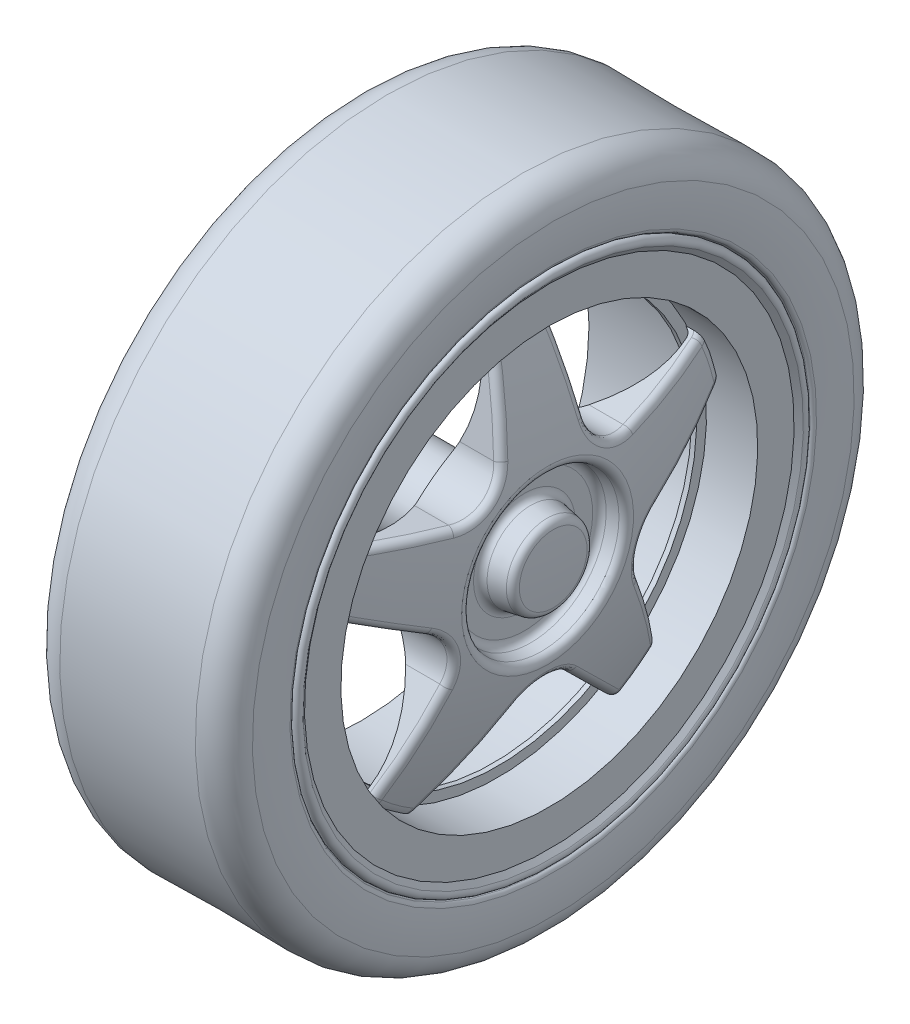
from build123d import *

# Parameters (mm, degrees)
CORTAR_EXTRUIR1_START = 28.999999999999996
CORTAR_EXTRUIR1_DEPTH = 28.999999999999996
MATRIZC1_COUNT        = 5
REDONDEO1_R           = 0.75
REDONDEO2_R           = 0.75
CORTAR_EXTRUIR2_DEPTH = 10


# Read off the part's stored shape, not the designer's step: Cortar-Revolución4
with BuildPart() as part:
    # Croquis1 → Revolución1 (revolve)
    with BuildSketch(Plane.XY):
        with BuildLine():
            Line((2.5, 24.999999999999996), (0.7352941176470583, 25.941176470588232))
            ThreePointArc((0.7352941176470585, 25.941176470588232), (0.12020814131487328, 25.825204772530324), (0.100301875811656, 25.199597920246344))
            Line((0.10030187581165524, 25.199597920246344), (0.5, 24.667782059947733))
            Line((0.5, 24.667782059947733), (0.5000000000000004, 20.999999999999996))
            Line((0.5000000000000004, 20.999999999999996), (13.83221794005226, 20.999999999999996))
            Line((13.83221794005226, 20.999999999999996), (15.83221794005226, 20.999999999999996))
            Line((15.83221794005226, 20.999999999999996), (19.5, 20.999999999999996))
            Line((19.5, 20.999999999999996), (19.5, 24.667782059947736))
            Line((19.5, 24.667782059947736), (19.899698124188344, 25.19959792024635))
            ThreePointArc((19.899698124188347, 25.19959792024635), (19.879791858685124, 25.825204772530324), (19.264705882352946, 25.941176470588236))
            Line((19.264705882352946, 25.941176470588236), (17.499999999999996, 25))
            Line((17.499999999999996, 25), (2.5, 24.999999999999996))
        make_face()
    revolve(axis=Axis((20, 0, 0), (-1, -1.2e-16, 0)))


with BuildPart() as body_2:
    # Croquis1<3> → Revolución2 (revolve)
    with BuildSketch(Plane.XY):
        with BuildLine():
            ThreePointArc((15.229709414249836, 20.044993192200682), (14.678536500553854, 20.73844454625571), (13.83221794005226, 20.999999999999996))
            Line((13.83221794005226, 20.999999999999996), (15.83221794005226, 20.999999999999996))
            ThreePointArc((15.83221794005226, 20.999999999999996), (16.01691722525036, 20.715355517227323), (16.161370397048206, 20.408321987001138))
            ThreePointArc((16.161370397048206, 20.408321987001138), (18.159269913999402, 14.261864726586808), (19.437899090853012, 7.926594664305913))
            Line((19.437899090853012, 7.926594664305913), (17.000000000000004, 7.5))
            Line((17.000000000000004, 7.5), (16.999999999999996, 4.500000000000001))
            Line((16.999999999999996, 4.500000000000001), (19.857395198343077, 4))
            ThreePointArc((19.857395198343077, 4), (19.96433747853814, 2.0012706044820376), (20, 0))
            Line((20, 0), (-4.999999999999995, -3.06e-15))
            Line((-4.999999999999995, -3.06e-15), (-4.999999999999994, 4))
            Line((-4.999999999999994, 4), (7.41803141324657, 6.172963582434665))
            ThreePointArc((7.41803141324657, 6.172963582434665), (14.609153979008614, 11.25895513363789), (15.229709414249836, 20.044993192200682))
        make_face()
    revolve(axis=Axis((20, 0, 0), (-1, -1.2e-16, 0)))

    # Croquis2 → Cortar-Extruir1 (cut)
    with BuildSketch(Plane(origin=(0, 0, 0), x_dir=(0, 0, -1), z_dir=(1, 0, 0)).offset(CORTAR_EXTRUIR1_START)):
        with BuildLine():
            ThreePointArc((-19.032482471529132, 8.874942871418174), (-12.343490298141932, 16.989356881873892), (-2.5592117207636766, 20.843474647196086))
            Line((-2.5592117207636766, 20.843474647196086), (-4.238740146298038, 10.618509398268122))
            ThreePointArc((-4.238740146298038, 10.618509398268122), (-5.834705949164168, 8.030783779695161), (-8.788959816618782, 7.312581296013566))
            Line((-8.788959816618782, 7.312581296013566), (-19.032482471529132, 8.874942871418174))
        make_face()
    cortar_extruir1 = extrude(amount=-CORTAR_EXTRUIR1_DEPTH, mode=Mode.SUBTRACT)

    # MatrizC1: Cortar-Extruir1 ×5 about axis
    matrizc1_axis = Axis((0, 1.5e-15, -3.8e-16), (1, 0, 0))
    for i in range(1, MATRIZC1_COUNT):
        add(cortar_extruir1.rotate(matrizc1_axis, i * 360 / MATRIZC1_COUNT), mode=Mode.SUBTRACT)


with BuildPart() as cortar_revoluci_n1_tool:
    # Croquis3 → Cortar-Revolución1 (revolve)
    with BuildSketch(Plane.XY):
        Polygon((14.332217940052262, 19.499999999999996), (14.332217940052264, 22.499999999999993), (14.332217940052264, 22.999999999999993), (13.83221794005226, 22.999999999999993), (13.83221794005226, 20.999999999999996), (13.83221794005226, 19.499999999999996), align=None)
        Polygon((13.83221794005226, 20.999999999999996), (13.83221794005226, 22.999999999999993), (-1.1677820599477382, 22.999999999999986), (-1.1677820599477386, 20.999999999999982), align=None)
    revolve(axis=Axis((7.418031413246568, -1.54e-15, 0), (-1, -1.2e-16, 0)))


with BuildPart() as part_1:
    add(part.part)

    # Cortar-Revolución1: cut by cortar_revoluci_n1_tool
    add(cortar_revoluci_n1_tool.part, mode=Mode.SUBTRACT)

    # Croquis4 → Revolución3 (revolve)
    with BuildSketch(Plane.XY):
        with BuildLine():
            Line((14.332217940052264, 22.999999999999993), (13.832217940052262, 22.999999999999993))
            Line((13.832217940052262, 22.999999999999993), (12.332217940052265, 22.999999999999996))
            ThreePointArc((12.332217940052265, 22.999999999999996), (13.392878111832086, 22.56066017177982), (13.832217940052262, 21.499999999999996))
            Line((13.832217940052262, 21.499999999999996), (13.832217940052262, 19.999999999999996))
            Line((13.832217940052262, 19.999999999999996), (14.332217940052264, 19.999999999999996))
            Line((14.332217940052264, 19.999999999999996), (14.332217940052264, 22.999999999999993))
        make_face()
    revolve(axis=Axis((7.418031413246568, -1.54e-15, 0), (-1, -1.2e-16, 0)))


with BuildPart() as body_2_1:
    add(body_2.part)

    # Cortar-Revolución1: cut by cortar_revoluci_n1_tool
    add(cortar_revoluci_n1_tool.part, mode=Mode.SUBTRACT)

    # Redondeo1
    redondeo1_edges = [body_2_1.edges().sort_by_distance(p)[0] for p in [
        (16.017390352561375, -18.157716094822753, -9.969355513847564),
        (17.713468801645313, -14.549912860999985, -6.320010510851247),
        (19.115914274162588, -9.926594664307888, -2.471356e-11),
        (16.017390352561375, -18.157716094822757, 9.969355513847558),
        (17.713468801645313, -14.549912860999985, 6.320010510851239),
        (17.000000000000004, -7.5, -4.25e-15),
        (16.01739035256137, -15.09246337704348, 14.188313936274088),
        (17.713468801645327, -10.506857520122566, 11.884798785499381),
        (19.11591427416263, -3.067486447566317, 9.44075254010308),
        (16.017390352561375, 3.870377672372002, 20.349714489763052),
        (17.713468801645355, 1.514516838675414, 15.79078009046219),
        (16.999999999999996, -4.500000000000001, -5.5e-16),
        (19.857395198343077, -4, -4.9e-16),
        (19.11591427416269, 8.030783779682231, 5.834705949185325),
        (16.01739035256137, 20.54974104564736, 2.607459702182234),
        (17.713468801645412, 15.485935743835702, 3.4392282939293777),
        (16.01739035256137, 8.830060753846865, 18.738215769518757),
        (17.71346880164539, 8.056317798611854, 13.665220109743553),
        (16.01739035256137, 20.54974104564736, -2.607459702182232),
        (17.713468801645405, 15.485935743835707, -3.439228293929376),
        (19.11591427416269, 8.030783779711285, -5.834705949145338),
        (16.01739035256137, 8.830060753846867, -18.738215769518757),
        (17.71346880164539, 8.056317798611854, -13.665220109743546),
        (16.01739035256137, 3.870377672372008, -20.349714489763052),
        (17.713468801645355, 1.5145168386754158, -15.790780090462187),
        (19.115914274162627, -3.0674864475193098, -9.440752540118355),
        (16.017390352561375, -15.092463377043474, -14.18831393627409),
        (17.713468801645327, -10.506857520122566, -11.884798785499385),
    ]]
    fillet(redondeo1_edges, radius=REDONDEO1_R)

    # Cortar-Revolución4 outline → Cortar-Revolución4 (revolve, cut)
    with BuildSketch(Plane.YX):
        Polygon((4, -5), (6.172963582, 7.418031413), (10.776802277, 7.418031413), (10.776802277, 14.320012605), (4, 10), align=None)
    revolve(axis=Axis((0, 0, 0), (1, 0, 0)), mode=Mode.SUBTRACT)

    # Redondeo2
    redondeo2_edges = [body_2_1.edges().sort_by_distance(p)[0] for p in [
        (19.437899090853016, -7.926594664305911, -9.7e-16),
    ]]
    fillet(redondeo2_edges, radius=REDONDEO2_R)

    # Croquis8 → Cortar-Extruir2 (cut)
    with BuildSketch(Plane.ZY.offset(4.999999999999994)):
        with BuildLine():
            Line((-1.7999999999999998, 2.012461179749811), (-1.7999999999999998, -2.012461179749811))
            ThreePointArc((-1.7999999999999998, -2.012461179749811), (3.8e-16, -2.6999999999999966), (1.8000000000000003, -2.012461179749811))
            Line((1.8000000000000003, -2.012461179749811), (1.8000000000000003, 2.012461179749811))
            ThreePointArc((1.8000000000000003, 2.012461179749811), (3.8e-16, 2.6999999999999993), (-1.7999999999999998, 2.012461179749811))
        make_face()
    extrude(amount=-CORTAR_EXTRUIR2_DEPTH, mode=Mode.SUBTRACT)


with BuildPart() as body_3:
    # Croquis7 → Revolución4 (revolve)
    with BuildSketch(Plane.XY):
        with BuildLine():
            Line((19.638075261313737, 26.140306806033994), (17.499999999999996, 25))
            Line((17.499999999999996, 25), (2.5, 24.999999999999996))
            Line((2.5, 24.999999999999996), (0.36192473868625213, 26.140306806033994))
            ThreePointArc((0.36192473868625213, 26.140306806033994), (0.18263537681055253, 26.30198276051036), (0.1, 26.528820112013626))
            ThreePointArc((0.1, 26.528820112013626), (7.11e-15, 28.422399549832626), (0.1, 30.315978987651633))
            ThreePointArc((0.1, 30.315978987651633), (1.1092664497680278, 32.259012986390495), (3.170041743989857, 32.998746096104654))
            ThreePointArc((3.170041743989857, 32.998746096104654), (10.000000000000023, 32.89999999999998), (16.829958256010144, 32.998746096104654))
            ThreePointArc((16.829958256010144, 32.998746096104654), (18.89073355023197, 32.25901298639051), (19.900000000000006, 30.31597898765165))
            ThreePointArc((19.900000000000006, 30.31597898765165), (20.00000000000001, 28.422399549832637), (19.899999999999995, 26.528820112013623))
            ThreePointArc((19.899999999999995, 26.528820112013623), (19.81736462318944, 26.301982760510352), (19.638075261313737, 26.140306806033994))
        make_face()
    revolve(axis=Axis((20, 0, 0), (-1, -1.2e-16, 0)))


solid = Compound([part_1.part, body_2_1.part, body_3.part])
